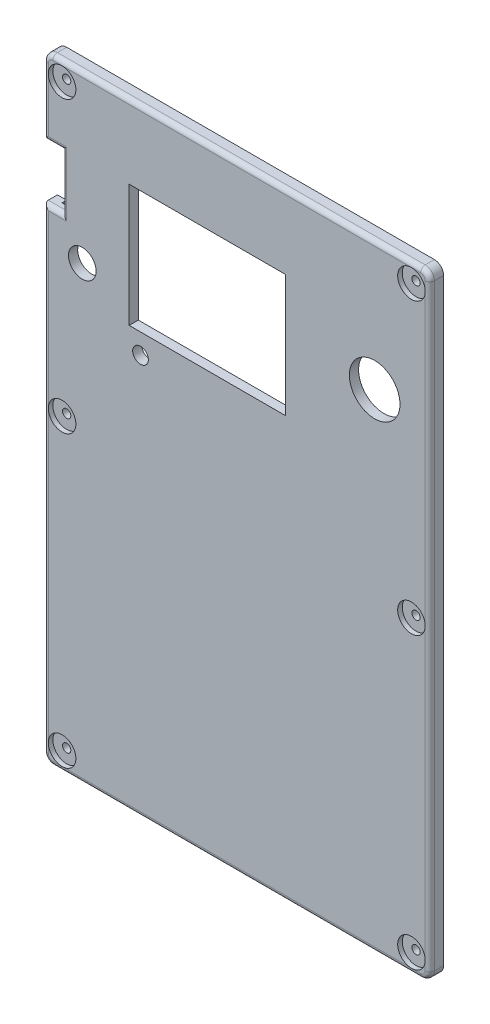
from build123d import *

# Parameters (mm, degrees)
SKETCH3_R           = 1.143
BOSS_EXTRUDE3_DEPTH = 3.81
CUT_EXTRUDE9_DEPTH  = 1.27
CUT_EXTRUDE10_DEPTH = 201.888951662
SKETCH11_W          = 43.18
SKETCH11_H          = 33.782
SKETCH11_R          = 3.81
SKETCH11_R_2        = 2.159
SKETCH11_R_3        = 6.985
CUT_EXTRUDE11_DEPTH = 201.888951662
CUT_EXTRUDE12_START = -1.27
SKETCH12_R          = 3.81
CUT_EXTRUDE12_DEPTH = 1.27
FILLET1_R           = 1.27


with BuildPart() as part:
    # Sketch3 → Boss-Extrude3 (new body)
    # profile 1 of 2: a face of its own
    with BuildSketch(Plane.XY):
        with BuildLine():
            Line((104.14, 0), (2.54, 0))
            ThreePointArc((2.54, 0), (0.743948776, -0.743948776), (0, -2.54))
            Line((0, -2.54), (0, -167.64))
            ThreePointArc((0, -167.64), (0.743948776, -169.436051224), (2.54, -170.18))
            Line((2.54, -170.18), (104.14, -170.18))
            ThreePointArc((104.14, -170.18), (105.936051224, -169.436051224), (106.68, -167.64))
            Line((106.68, -167.64), (106.68, -2.54))
            ThreePointArc((106.68, -2.54), (105.936051224, -0.743948776), (104.14, 0))
        make_face()
        with Locations(Location((101.6, -85.09, 0), (0, 0, 180))):
            Circle(SKETCH3_R, mode=Mode.SUBTRACT)
        with Locations(Location((5.08, -85.09, 0), (0, 0, 180))):
            Circle(SKETCH3_R, mode=Mode.SUBTRACT)
        with Locations(Location((5.08, -165.1, 0), (0, 0, 180))):
            Circle(SKETCH3_R, mode=Mode.SUBTRACT)
        with Locations(Location((101.6, -165.1, 0), (0, 0, 180))):
            Circle(SKETCH3_R, mode=Mode.SUBTRACT)
        with Locations(Location((5.08, -5.08, 0), (0, 0, 180))):
            Circle(SKETCH3_R, mode=Mode.SUBTRACT)
        with Locations(Location((101.6, -5.08, 0), (0, 0, 180))):
            Circle(SKETCH3_R, mode=Mode.SUBTRACT)
        with BuildLine():
            ThreePointArc((10.899871133, -2.54), (9.401860858, -3.199050905), (8.87556813, -4.748695652))
            ThreePointArc((8.87556813, -4.748695652), (7.774076836, -7.774076836), (4.748695652, -8.87556813))
            ThreePointArc((4.748695652, -8.87556813), (3.199050905, -9.401860858), (2.54, -10.899871133))
            Line((2.54, -10.899871133), (2.54, -79.270128867))
            ThreePointArc((2.54, -79.270128867), (3.199050905, -80.768139142), (4.748695652, -81.29443187))
            ThreePointArc((4.748695652, -81.29443187), (8.89, -85.09), (4.748695652, -88.88556813))
            ThreePointArc((4.748695652, -88.88556813), (3.199050905, -89.411860858), (2.54, -90.909871133))
            Line((2.54, -90.909871133), (2.54, -159.280128867))
            ThreePointArc((2.54, -159.280128867), (3.199050905, -160.778139142), (4.748695652, -161.30443187))
            ThreePointArc((4.748695652, -161.30443187), (7.774076836, -162.405923164), (8.87556813, -165.431304348))
            ThreePointArc((8.87556813, -165.431304348), (9.401860858, -166.980949095), (10.899871133, -167.64))
            Line((10.899871133, -167.64), (95.780128867, -167.64))
            ThreePointArc((95.780128867, -167.64), (97.278139142, -166.980949095), (97.80443187, -165.431304348))
            ThreePointArc((97.80443187, -165.431304348), (98.905923164, -162.405923164), (101.931304348, -161.30443187))
            ThreePointArc((101.931304348, -161.30443187), (103.480949095, -160.778139142), (104.14, -159.280128867))
            Line((104.14, -159.280128867), (104.14, -90.909871133))
            ThreePointArc((104.14, -90.909871133), (103.480949095, -89.411860858), (101.931304348, -88.88556813))
            ThreePointArc((101.931304348, -88.88556813), (97.79, -85.09), (101.931304348, -81.29443187))
            ThreePointArc((101.931304348, -81.29443187), (103.480949095, -80.768139142), (104.14, -79.270128867))
            Line((104.14, -79.270128867), (104.14, -10.899871133))
            ThreePointArc((104.14, -10.899871133), (103.480949095, -9.401860858), (101.931304348, -8.87556813))
            ThreePointArc((101.931304348, -8.87556813), (98.905923164, -7.774076836), (97.80443187, -4.748695652))
            ThreePointArc((97.80443187, -4.748695652), (97.278139142, -3.199050905), (95.780128867, -2.54))
            Line((95.780128867, -2.54), (10.899871133, -2.54))
        make_face(mode=Mode.SUBTRACT)
    # profile 2 of 2: a face of its own
    with BuildSketch(Plane.XY):
        with BuildLine():
            Line((10.899871133, -2.54), (95.780128867, -2.54))
            ThreePointArc((95.780128867, -2.54), (97.278139142, -3.199050905), (97.80443187, -4.748695652))
            ThreePointArc((97.80443187, -4.748695652), (98.905923164, -7.774076836), (101.931304348, -8.87556813))
            ThreePointArc((101.931304348, -8.87556813), (103.480949095, -9.401860858), (104.14, -10.899871133))
            Line((104.14, -10.899871133), (104.14, -79.270128867))
            ThreePointArc((104.14, -79.270128867), (103.480949095, -80.768139142), (101.931304348, -81.29443187))
            ThreePointArc((101.931304348, -81.29443187), (97.79, -85.09), (101.931304348, -88.88556813))
            ThreePointArc((101.931304348, -88.88556813), (103.480949095, -89.411860858), (104.14, -90.909871133))
            Line((104.14, -90.909871133), (104.14, -159.280128867))
            ThreePointArc((104.14, -159.280128867), (103.480949095, -160.778139142), (101.931304348, -161.30443187))
            ThreePointArc((101.931304348, -161.30443187), (98.905923164, -162.405923164), (97.80443187, -165.431304348))
            ThreePointArc((97.80443187, -165.431304348), (97.278139142, -166.980949095), (95.780128867, -167.64))
            Line((95.780128867, -167.64), (10.899871133, -167.64))
            ThreePointArc((10.899871133, -167.64), (9.401860858, -166.980949095), (8.87556813, -165.431304348))
            ThreePointArc((8.87556813, -165.431304348), (7.774076836, -162.405923164), (4.748695652, -161.30443187))
            ThreePointArc((4.748695652, -161.30443187), (3.199050905, -160.778139142), (2.54, -159.280128867))
            Line((2.54, -159.280128867), (2.54, -90.909871133))
            ThreePointArc((2.54, -90.909871133), (3.199050905, -89.411860858), (4.748695652, -88.88556813))
            ThreePointArc((4.748695652, -88.88556813), (8.89, -85.09), (4.748695652, -81.29443187))
            ThreePointArc((4.748695652, -81.29443187), (3.199050905, -80.768139142), (2.54, -79.270128867))
            Line((2.54, -79.270128867), (2.54, -10.899871133))
            ThreePointArc((2.54, -10.899871133), (3.199050905, -9.401860858), (4.748695652, -8.87556813))
            ThreePointArc((4.748695652, -8.87556813), (7.774076836, -7.774076836), (8.87556813, -4.748695652))
            ThreePointArc((8.87556813, -4.748695652), (9.401860858, -3.199050905), (10.899871133, -2.54))
        make_face()
    extrude(amount=BOSS_EXTRUDE3_DEPTH)

    # Sketch7 → Cut-Extrude9 (cut)
    with BuildSketch(Plane(origin=(0, 0, 0), x_dir=(-1, 0, 0), z_dir=(0, 0, -1))):
        with BuildLine():
            Line((-95.780128867, -2.54), (-10.899871133, -2.54))
            ThreePointArc((-10.899871133, -2.54), (-9.401860858, -3.199050905), (-8.87556813, -4.748695652))
            ThreePointArc((-8.87556813, -4.748695652), (-7.774076836, -7.774076836), (-4.748695652, -8.87556813))
            ThreePointArc((-4.748695652, -8.87556813), (-3.199050905, -9.401860858), (-2.54, -10.899871133))
            Line((-2.54, -10.899871133), (-2.54, -79.270128867))
            ThreePointArc((-2.54, -79.270128867), (-3.199050905, -80.768139142), (-4.748695652, -81.29443187))
            ThreePointArc((-4.748695652, -81.29443187), (-8.89, -85.09), (-4.748695652, -88.88556813))
            ThreePointArc((-4.748695652, -88.88556813), (-3.199050905, -89.411860858), (-2.54, -90.909871133))
            Line((-2.54, -90.909871133), (-2.54, -159.280128867))
            ThreePointArc((-2.54, -159.280128867), (-3.199050905, -160.778139142), (-4.748695652, -161.30443187))
            ThreePointArc((-4.748695652, -161.30443187), (-7.774076836, -162.405923164), (-8.87556813, -165.431304348))
            ThreePointArc((-8.87556813, -165.431304348), (-9.401860858, -166.980949095), (-10.899871133, -167.64))
            Line((-10.899871133, -167.64), (-95.780128867, -167.64))
            ThreePointArc((-95.780128867, -167.64), (-97.278139142, -166.980949095), (-97.80443187, -165.431304348))
            ThreePointArc((-97.80443187, -165.431304348), (-98.905923164, -162.405923164), (-101.931304348, -161.30443187))
            ThreePointArc((-101.931304348, -161.30443187), (-103.480949095, -160.778139142), (-104.14, -159.280128867))
            Line((-104.14, -159.280128867), (-104.14, -90.909871133))
            ThreePointArc((-104.14, -90.909871133), (-103.480949095, -89.411860858), (-101.931304348, -88.88556813))
            ThreePointArc((-101.931304348, -88.88556813), (-97.79, -85.09), (-101.931304348, -81.29443187))
            ThreePointArc((-101.931304348, -81.29443187), (-103.480949095, -80.768139142), (-104.14, -79.270128867))
            Line((-104.14, -79.270128867), (-104.14, -36.557585396))
            Line((-104.14, -36.557585396), (-104.14, -10.899871133))
            ThreePointArc((-104.14, -10.899871133), (-103.480949095, -9.401860858), (-101.931304348, -8.87556813))
            ThreePointArc((-101.931304348, -8.87556813), (-98.905923164, -7.774076836), (-97.80443187, -4.748695652))
            ThreePointArc((-97.80443187, -4.748695652), (-97.278139142, -3.199050905), (-95.780128867, -2.54))
        make_face()
    extrude(amount=-CUT_EXTRUDE9_DEPTH, mode=Mode.SUBTRACT)

    # Sketch10 → Cut-Extrude10 (cut, through all)
    with BuildSketch(Plane.XY.offset(3.81)):
        Polygon((2.54, -21.336), (0, -21.336), (0, -36.576), (2.54, -36.576), (5.08, -36.576), (5.08, -21.336), align=None)
    extrude(amount=-CUT_EXTRUDE10_DEPTH, mode=Mode.SUBTRACT)

    # Sketch11 → Cut-Extrude11 (cut, through all)
    with BuildSketch(Plane.XY.offset(3.81)):
        with Locations((45.212, -37.211)):
            Rectangle(SKETCH11_W, SKETCH11_H)
        with Locations((10.668, -45.72)):
            Circle(SKETCH11_R)
        with Locations((26.7462, -59.69)):
            Circle(SKETCH11_R_2)
        with Locations((91.44, -35.56)):
            Circle(SKETCH11_R_3)
    extrude(amount=-CUT_EXTRUDE11_DEPTH, mode=Mode.SUBTRACT)

    # Sketch12 → Cut-Extrude12 (cut)
    with BuildSketch(Plane.XY.offset(3.81).offset(CUT_EXTRUDE12_START)):
        with Locations((5.08, -5.08)):
            Circle(SKETCH12_R)
        with Locations((101.6, -5.08)):
            Circle(SKETCH12_R)
        with Locations((101.6, -85.09)):
            Circle(SKETCH12_R)
        with Locations((101.6, -165.1)):
            Circle(SKETCH12_R)
        with Locations((5.08, -165.1)):
            Circle(SKETCH12_R)
        with Locations((5.08, -85.09)):
            Circle(SKETCH12_R)
    extrude(amount=CUT_EXTRUDE12_DEPTH, mode=Mode.SUBTRACT)

    # Fillet1
    fillet1_edges = [part.edges().sort_by_distance(p)[0] for p in [
        (0, -102.108, 3.81),
        (5.08, -28.956, 3.81),
        (2.54, -36.576, 3.81),
        (2.54, -21.336, 3.81),
        (53.34, 0, 3.81),
        (0.743948776, -0.743948776, 3.81),
        (0, -11.938, 3.81),
        (0.743948776, -169.436051224, 3.81),
        (53.34, -170.18, 3.81),
        (105.936051224, -169.436051224, 3.81),
        (106.68, -85.09, 3.81),
        (105.936051224, -0.743948776, 3.81),
    ]]
    fillet(fillet1_edges, radius=FILLET1_R - 0.0001)  # a hair under: the kernel refuses the full size


solid = part.part
